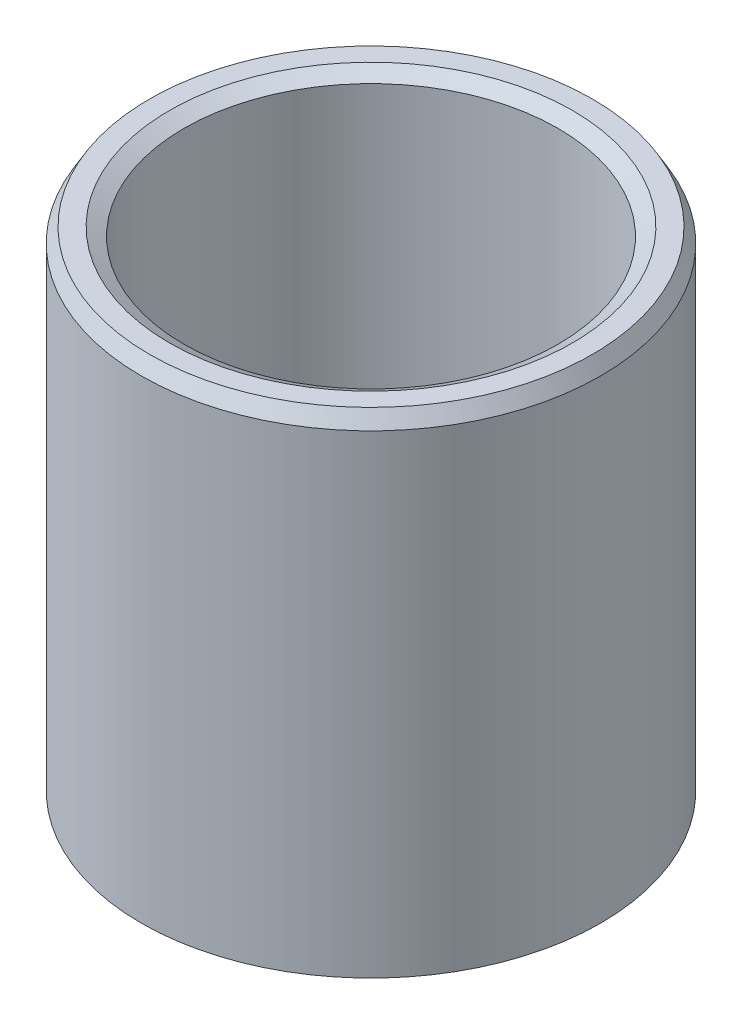
from build123d import *
from OCP.BRepFilletAPI import BRepFilletAPI_MakeChamfer

# Parameters (mm, degrees)
SKETCH1_R           = 22.5
BOSS_EXTRUDE1_DEPTH = 48.657604049
SKETCH2_R           = 18.322030548
CUT_EXTRUDE1_DEPTH  = 59.138304342
CHAMFER1_SIZE       = 1.413433858
CHAMFER1_SIZE2      = 0.816046418


with BuildPart() as part:
    # Sketch1 → Boss-Extrude1 (new body)
    with BuildSketch(Plane(origin=(0, 0, 0), x_dir=(1, 0, 0), z_dir=(0, 1, 0))):
        Circle(SKETCH1_R)
    extrude(amount=BOSS_EXTRUDE1_DEPTH)

    # Sketch2 → Cut-Extrude1 (cut, through all)
    with BuildSketch(Plane(origin=(0, 0, 0), x_dir=(1, 0, 0), z_dir=(0, 1, 0))):
        Circle(SKETCH2_R)
    extrude(amount=CUT_EXTRUDE1_DEPTH, mode=Mode.SUBTRACT)

    # Chamfer1: one chamfer whose edges measure the first distance from different faces: ONE call of the kernel's chamfer builder (chamfer() names one face for all edges)
    chamfer1_edges_1 = [part.edges().sort_by_distance(p)[0] for p in [
        (-18.322030548, 48.657604049, 0),
    ]]
    chamfer1_side_1 = [part.faces().sort_by_distance(p)[0] for p in [
        (-21.863603897, 48.657604049, 0),
    ]]
    chamfer1_edges_2 = [part.edges().sort_by_distance(p)[0] for p in [
        (-18.322030548, 0, 0),
    ]]
    chamfer1_side_2 = [part.faces().sort_by_distance(p)[0] for p in [
        (-18.322030548, 24.328802024, 0),
    ]]
    chamfer1_edges_3 = [part.edges().sort_by_distance(p)[0] for p in [
        (-22.5, 0, 0),
    ]]
    chamfer1_side_3 = [part.faces().sort_by_distance(p)[0] for p in [
        (-21.863603897, 0, 0),
    ]]
    chamfer1_edges_4 = [part.edges().sort_by_distance(p)[0] for p in [
        (-22.5, 48.657604049, 0),
    ]]
    chamfer1_side_4 = [part.faces().sort_by_distance(p)[0] for p in [
        (-22.5, 24.328802024, 0),
    ]]
    chamfer1 = BRepFilletAPI_MakeChamfer(part.part.solid().wrapped)
    for e in chamfer1_edges_1:
        chamfer1.Add(CHAMFER1_SIZE, CHAMFER1_SIZE2, e.wrapped, chamfer1_side_1[0].wrapped)  # the first distance lies on this face
    for e in chamfer1_edges_2:
        chamfer1.Add(CHAMFER1_SIZE, CHAMFER1_SIZE2, e.wrapped, chamfer1_side_2[0].wrapped)  # the first distance lies on this face
    for e in chamfer1_edges_3:
        chamfer1.Add(CHAMFER1_SIZE, CHAMFER1_SIZE2, e.wrapped, chamfer1_side_3[0].wrapped)  # the first distance lies on this face
    for e in chamfer1_edges_4:
        chamfer1.Add(CHAMFER1_SIZE, CHAMFER1_SIZE2, e.wrapped, chamfer1_side_4[0].wrapped)  # the first distance lies on this face
    add(Compound.cast(chamfer1.Shape()), mode=Mode.REPLACE)


solid = part.part
